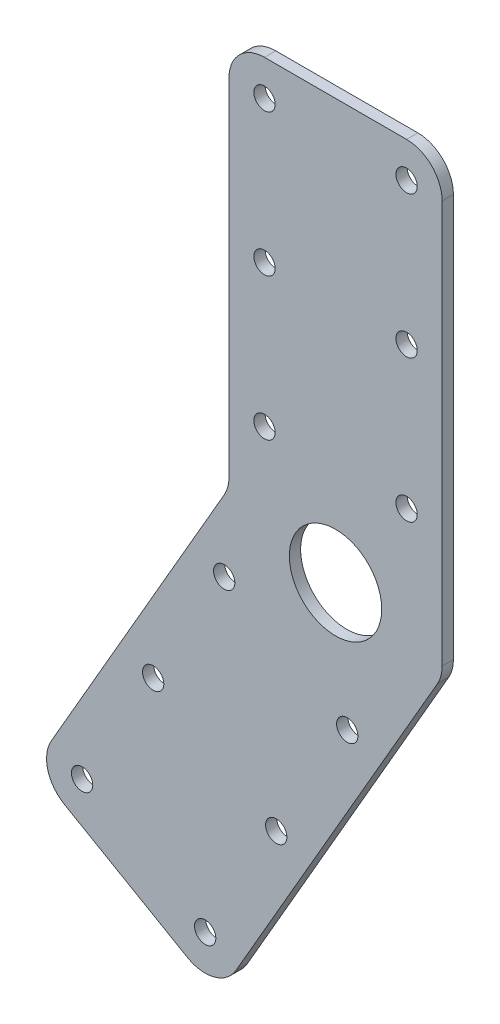
from build123d import *

# Parameters (mm, degrees)
SKETCH1_R           = 6.5
SKETCH1_R_2         = 1.5
BOSS_EXTRUDE1_DEPTH = 1.5875
FILLET1_R           = 5


with BuildPart() as part:
    # Sketch1 → Boss-Extrude1 (new body)
    with BuildSketch(Plane.XY):
        Polygon((0, 0), (0, 55), (30, 55), (30, -8.038475773), (-1.519237886, -62.631397208), (-27.5, -47.631397208), align=None)
        with Locations((15, -4.019237886)):
            Circle(SKETCH1_R, mode=Mode.SUBTRACT)
        with Locations((5, 50)):
            Circle(SKETCH1_R_2, mode=Mode.SUBTRACT)
        with Locations((5, 30)):
            Circle(SKETCH1_R_2, mode=Mode.SUBTRACT)
        with Locations((5, 10)):
            Circle(SKETCH1_R_2, mode=Mode.SUBTRACT)
        with Locations((25, 10)):
            Circle(SKETCH1_R_2, mode=Mode.SUBTRACT)
        with Locations((25, 30)):
            Circle(SKETCH1_R_2, mode=Mode.SUBTRACT)
        with Locations((25, 50)):
            Circle(SKETCH1_R_2, mode=Mode.SUBTRACT)
        with Locations((-20.669872981, -45.801270189)):
            Circle(SKETCH1_R_2, mode=Mode.SUBTRACT)
        with Locations((-10.669872981, -28.480762114)):
            Circle(SKETCH1_R_2, mode=Mode.SUBTRACT)
        with Locations((-0.669872981, -11.160254038)):
            Circle(SKETCH1_R_2, mode=Mode.SUBTRACT)
        with Locations((16.650635095, -21.160254038)):
            Circle(SKETCH1_R_2, mode=Mode.SUBTRACT)
        with Locations((6.650635095, -38.480762114)):
            Circle(SKETCH1_R_2, mode=Mode.SUBTRACT)
        with Locations((-3.349364905, -55.801270189)):
            Circle(SKETCH1_R_2, mode=Mode.SUBTRACT)
    extrude(amount=BOSS_EXTRUDE1_DEPTH)

    # Fillet1
    fillet1_edges = [part.edges().sort_by_distance(p)[0] for p in [
        (30, -8.038475773, 0.79375),
        (0, 0, 0.79375),
        (-1.519237886, -62.631397208, 0.79375),
        (-27.5, -47.631397208, 0.79375),
        (0, 55, 0.79375),
        (30, 55, 0.79375),
    ]]
    fillet(fillet1_edges, radius=FILLET1_R)


solid = part.part
